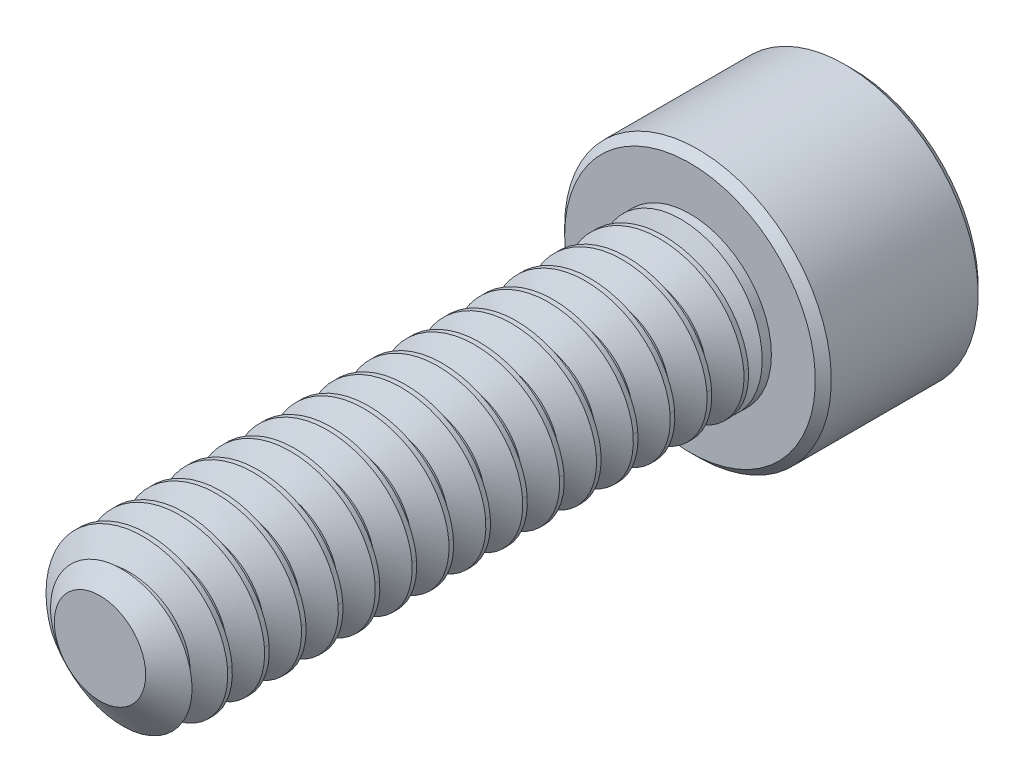
from build123d import *

# Parameters (mm, degrees)
SKETCH1_R          = 1.7526
EXTRUDE1_DEPTH     = 12.7
CUT_SWEEP1_PITCH   = 0.79375
SKETCH6_R          = 2.8702
EXTRUDE2_DEPTH     = 3.5052
CUT_EXTRUDE1_DEPTH = 2.08359375
CHAMFER1_SIZE      = 0.172212


with BuildPart() as part:
    # Sketch1 → Extrude1 (new body)
    with BuildSketch(Plane.XY):
        Circle(SKETCH1_R)
    extrude(amount=-EXTRUDE1_DEPTH)

    # Cut-Sweep1: arcs per turn and ends read off the stored shape
    # Cut-Sweep1: the profile of Sketch3 profile screwed along a right-hand helix through 19 turns, 6 arcs to a turn; built about Z, then put on its axis
    cut_sweep1_z = Axis((0, 0, 0), (0, 0, 1))
    cut_sweep1_corners = [(1.7529, 0, -1.488454455), (1.237044252, 0, -1.190625), (1.237044252, 0, -1.09140625), (1.7529, 0, -0.793576795)]
    with BuildLine(mode=Mode.PRIVATE) as cut_sweep1_profile:
        Line(cut_sweep1_corners[0], cut_sweep1_corners[1])
        Line(cut_sweep1_corners[1], cut_sweep1_corners[2])
        Line(cut_sweep1_corners[2], cut_sweep1_corners[3])
        Line(cut_sweep1_corners[3], cut_sweep1_corners[0])
    cut_sweep1_cap = Face(cut_sweep1_profile.wire())
    cut_sweep1_turn_angles = [0, 30, 60, 90, 120, 150, 180, 210, 240, 270, 300, 330, 360]
    cut_sweep1_turn_weights = [1, 0.8660254037844387, 1, 0.8660254037844387, 1, 0.8660254037844387, 1, 0.8660254037844387, 1, 0.8660254037844387, 1, 0.8660254037844387, 1]
    cut_sweep1_turn_rails = [Edge.make_bspline([Vector(p[0], p[1], 0).rotate(cut_sweep1_z, cut_sweep1_turn_angles[k]) / cut_sweep1_turn_weights[k] + Vector(0, 0, p[2] + CUT_SWEEP1_PITCH * cut_sweep1_turn_angles[k] / 360) for k in range(13)], [0, 0, 0, 1, 1, 2, 2, 3, 3, 4, 4, 5, 5, 6, 6, 6], 2, cut_sweep1_turn_weights) for p in cut_sweep1_corners]
    cut_sweep1_turn_sides = [Face.make_surface_from_curves(cut_sweep1_turn_rails[p[0]], cut_sweep1_turn_rails[p[1]]) for p in [(0, 1), (1, 2), (2, 3), (3, 0)]]
    cut_sweep1 = Plane(origin=(0, 0, 0), x_dir=(0, 1, 0), z_dir=(0, 0, -1)) * Solid(Shell([*[p.moved(Location((0, 0, CUT_SWEEP1_PITCH * i))) for i in range(19) for p in cut_sweep1_turn_sides], cut_sweep1_cap, cut_sweep1_cap.rotate(cut_sweep1_z, 6840).moved(Location((0, 0, CUT_SWEEP1_PITCH * 6840 / 360)))]))
    add(cut_sweep1, mode=Mode.SUBTRACT)

    # Sketch4 → Cut-Revolve1 (revolve, cut)
    with BuildSketch(Plane(origin=(0, 0, 0), x_dir=(0, 0, -1), z_dir=(1, 0, 0)), mode=Mode.PRIVATE) as cut_revolve1_sk:
        Polygon((0.538848736, 1.7526), (0, 0.983044252), (0, 1.7526), align=None)
    revolve(cut_revolve1_sk.sketch.rotate(Axis((0, 0, 0), (0, 0, -1)), 90), axis=Axis((0, 0, 0), (0, 0, -1)), mode=Mode.SUBTRACT)

    # Sketch6 → Extrude2 (add)
    with BuildSketch(Plane(origin=(0, 0, -12.7), x_dir=(-1, 0, 0), z_dir=(0, 0, -1))):
        Circle(SKETCH6_R)
    extrude(amount=EXTRUDE2_DEPTH)

    # Sketch7 → Cut-Extrude1 (cut)
    with BuildSketch(Plane(origin=(0, 0, -16.2052), x_dir=(-1, 0, 0), z_dir=(0, 0, -1))):
        Polygon((0, 1.603951217), (-1.3890625, 0.801975608), (-1.3890625, -0.801975608), (0, -1.603951217), (1.3890625, -0.801975608), (1.3890625, 0.801975608), align=None)
    extrude(amount=-CUT_EXTRUDE1_DEPTH, mode=Mode.SUBTRACT)

    # Cut-Extrude2 cone 1 section (through the dimple's axis) → Cut-Extrude2 (revolve, cut)
    with BuildSketch(Plane(origin=(0, 0, -16.2052), x_dir=(0, 1, 0), z_dir=(1, 0, 0))):
        Polygon((0, 0), (1.603951217, 0), (0, 1.603951217), align=None)
    revolve(axis=Axis((0, 0, -16.2052), (0, 0, 1)), mode=Mode.SUBTRACT)

    # Chamfer1
    chamfer1_edges = [part.edges().sort_by_distance(p)[0] for p in [
        (2.8702, 0, -12.7),
        (2.8702, 0, -16.2052),
    ]]
    chamfer(chamfer1_edges, length=CHAMFER1_SIZE)

    # Sketch10 → Revolve1 (revolve)
    with BuildSketch(Plane(origin=(0, 0, 0), x_dir=(0, 0, -1), z_dir=(1, 0, 0)), mode=Mode.PRIVATE) as revolve1_sk:
        Polygon((12.7, 1.7526), (12.7, 0), (11.775611811, 0), (12.5015625, 1.7526), align=None)
    revolve(revolve1_sk.sketch.rotate(Axis((0, 0, -12.7), (0, 0, 1)), 270), axis=Axis((0, 0, -12.7), (0, 0, 1)))


solid = part.part
